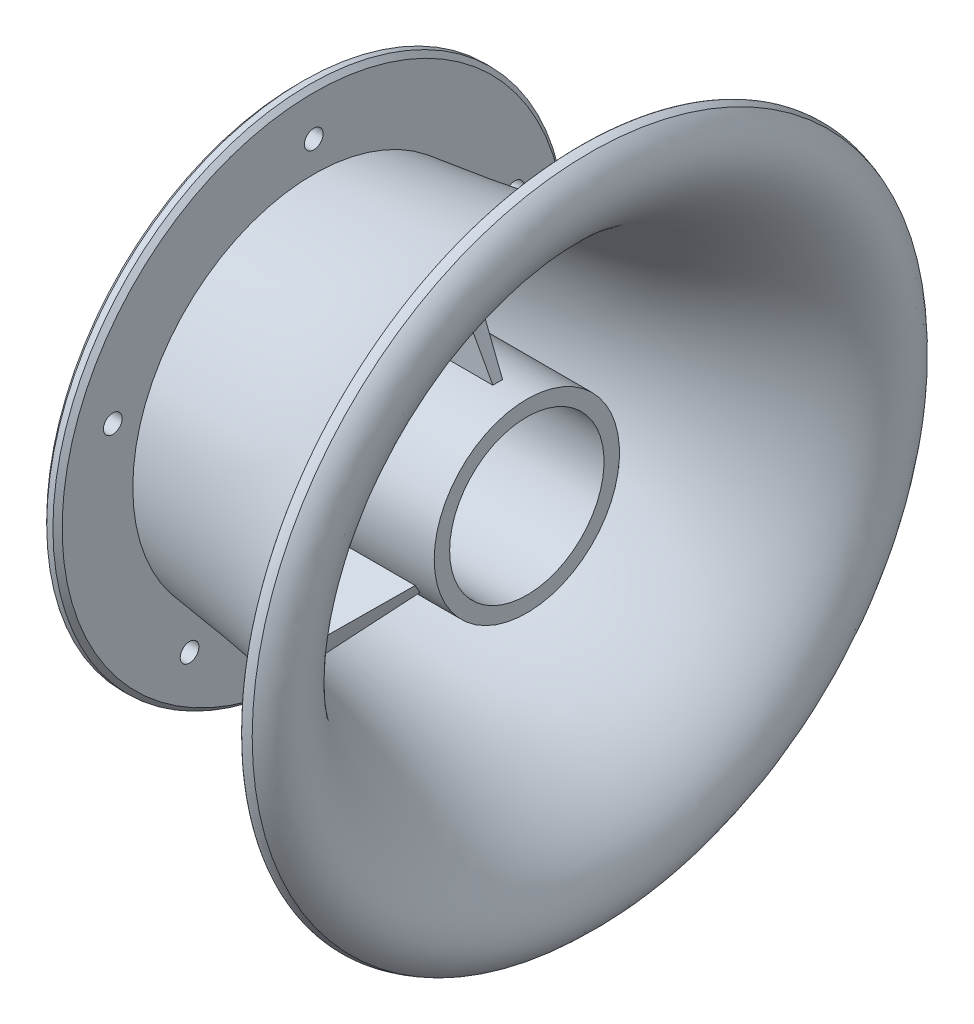
from build123d import *

# Parameters (mm, degrees)
REVOLVE2_ANGLE    = 6
CIRPATTERN2_COUNT = 3
CHAMFER1_SIZE     = 1.5
SKETCH4_W         = 3.0226
SKETCH4_H         = 5
CIRPATTERN4_COUNT = 5


# Read off the part's stored shape, not the designer's step: Revolve2
with BuildPart() as part:
    # Sketch1 → Revolve1 (revolve)
    with BuildSketch(Plane.XY, mode=Mode.PRIVATE) as revolve1_sk:
        with BuildLine():
            Line((0, 58), (0, 83))
            Line((0, 83), (5, 83))
            Line((5, 83), (5, 58.620808853))
            add(Edge.make_bspline(
                [(5, 58.620808853), (13.169016264, 59.612357006), (37.205568866, 62.450736308), (71.511619786, 70.14291029), (103.053430821, 97.037237569), (92.477274422, 107.912180597)],
                knots=[0.042243071, 0.042243071, 0.042243071, 0.042243071, 0.249171509, 0.64167684, 1, 1, 1, 1], degree=3))
            add(Edge.make_bspline(
                [(92.477274422, 107.912180597), (89.507775887, 111.114313016), (94.343596803, 109.29464162)],
                knots=[0, 0, 0, 1, 1, 1], degree=2))
            add(Edge.make_bspline(
                [(0, 50), (27.09744583, 56.801790812), (62.542385387, 52.929895036), (108.936942342, 97.132810829), (94.343596803, 109.29464162)],
                knots=[0, 0, 0, 0, 0.617162194, 1, 1, 1, 1], degree=3))
            Line((0, 50), (0, 58))
        make_face()
        Polygon((25, 8), (30, 8), (30, 25), (74, 25), (74, 30), (24, 30), (24, 18), (20, 18), (20, 13), (25, 13), align=None)
    revolve(revolve1_sk.sketch.rotate(Axis((0, 0, 0), (1, 0, 0)), 90), axis=Axis((0, 0, 0), (1, 0, 0)))

    # Chamfer1
    chamfer1_edges = [part.edges().sort_by_distance(p)[0] for p in [
        (0, 0, -83),
        (5, 0, -83),
    ]]
    chamfer(chamfer1_edges, length=CHAMFER1_SIZE)

    # Sketch4 → B (0.238) Diameter Hole1 (revolve, cut)
    with BuildSketch(Plane(origin=(5, 68.456847529, 0), x_dir=(0, 0, -1), z_dir=(0, 1, 0))):
        with Locations((1.5113, 2.5)):
            Rectangle(SKETCH4_W, SKETCH4_H)
    b_0_238_diameter_hole1 = revolve(axis=Axis((11.35, 68.456847529, 0), (-1, 0, 0)), mode=Mode.SUBTRACT)

    # CirPattern4: B (0.238) Diameter Hole1 ×5 about axis
    cirpattern4_axis = Axis((0, 0, 0), (1, 0, 0))
    for i in range(1, CIRPATTERN4_COUNT):
        add(b_0_238_diameter_hole1.rotate(cirpattern4_axis, i * 360 / CIRPATTERN4_COUNT), mode=Mode.SUBTRACT)


with BuildPart() as body_2:
    # Revolve2 outline → Revolve2 (revolve)
    with BuildSketch(Plane(origin=(0, 0, 0), x_dir=(0, 0.9986295347545738, -0.052335956242944064), z_dir=(0, -0.052335956242944064, -0.9986295347545738))):
        with BuildLine():
            add(Edge.make_bspline(
                [(54.3792884, 23.210086414), (55.796873577, 32.557419826), (57.079838653, 41.563111058), (59.698837568, 50.729422534)],
                knots=[0.184972593, 0.184972593, 0.184972593, 0.184972593, 0.417484467, 0.417484467, 0.417484467, 0.417484467], degree=3))
            Line((59.698837568, 50.729422534), (30, 64.578873173))
            Line((30, 64.578873173), (30, 34.578873173))
            Line((30, 34.578873173), (54.3792884, 23.210086414))
        make_face()
    revolve(axis=Axis((0, 0, 0), (1, 0, 0)), revolution_arc=REVOLVE2_ANGLE)


with BuildPart() as cirpattern2_1:
    # CirPattern2: pattern copy
    add(body_2.part.rotate(Axis((0, 0, 0), (1, 0, 0)), 1 * 360 / CIRPATTERN2_COUNT))


with BuildPart() as cirpattern2_2:
    # CirPattern2: pattern copy
    add(body_2.part.rotate(Axis((0, 0, 0), (1, 0, 0)), 2 * 360 / CIRPATTERN2_COUNT))


solid = Compound([part.part, body_2.part, cirpattern2_1.part, cirpattern2_2.part])
